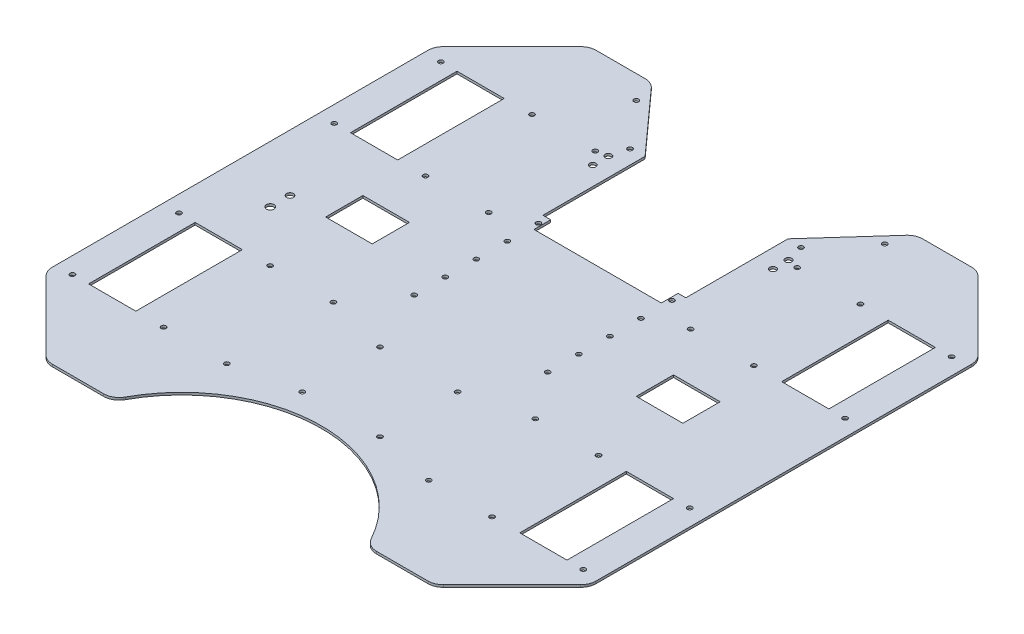
from build123d import *

# Parameters (mm, degrees)
SKETCH_1_R          = 1.55
SKETCH_1_W          = 30.4
SKETCH_1_H          = 68.58
SKETCH_1_R_2        = 2.5
SKETCH_1_R_3        = 2.205
SKETCH_1_R_4        = 2.05
EXTRUDE_1_DEPTH     = 1.5
FILLET_1_R          = 10
FILLET_2_R          = 10
FILLET_3_R          = 10
SKETCH_2_W          = 80
SKETCH_2_H          = 29.628438218
CUT_EXTRUDE_1_DEPTH = 10
SKETCH_3_W          = 30
SKETCH_3_H          = 24
CUT_EXTRUDE_2_DEPTH = 10
SKETCH_1_4_R        = 1.55
CUT_EXTRUDE_3_DEPTH = 10
SKETCH_5_W          = 92
SKETCH_5_H          = 68.528071536
CUT_EXTRUDE_4_DEPTH = 4
SKETCH_6_W          = 82
SKETCH_6_H          = 10.813051581
CUT_EXTRUDE_5_DEPTH = 10


with BuildPart() as part:
    # 草图1 → 凸台-拉伸1 (new body)
    with BuildSketch(Plane(origin=(0, 0, 0), x_dir=(1, 0, 0), z_dir=(0, 1, 0))):
        with BuildLine():
            Line((-85, 175), (-125, 175))
            Line((-125, 175), (-175, 125))
            Line((-175, 125), (-175, -125))
            Line((-175, -125), (-125, -175))
            Line((-125, -175), (-81.710313025, -175))
            ThreePointArc((-81.710313025, -175), (0, -122.728301649), (81.710313025, -175))
            Line((81.710313025, -175), (125, -175))
            Line((125, -175), (175, -125))
            Line((175, -125), (175, 125))
            Line((175, 125), (125, 175))
            Line((125, 175), (85, 175))
            Line((85, 175), (40, 125))
            Line((40, 125), (40, 85))
            Line((40, 85), (-40, 85))
            Line((-40, 85), (-40, 125))
            Line((-40, 125), (-85, 175))
        make_face()
        with Locations((-164.434, -118.58)):
            Circle(SKETCH_1_R, mode=Mode.SUBTRACT)
        with Locations((-105.72, -118.58)):
            Circle(SKETCH_1_R, mode=Mode.SUBTRACT)
        with Locations((-65, -118.58)):
            Circle(SKETCH_1_R, mode=Mode.SUBTRACT)
        with Locations((-25, -110)):
            Circle(SKETCH_1_R, mode=Mode.SUBTRACT)
        with Locations((-138.794, -84.29)):
            Rectangle(SKETCH_1_W, SKETCH_1_H, mode=Mode.SUBTRACT)
        with Locations((-164.434, -50)):
            Circle(SKETCH_1_R, mode=Mode.SUBTRACT)
        with Locations((-105.72, -50)):
            Circle(SKETCH_1_R, mode=Mode.SUBTRACT)
        with Locations((-138.472923085, -17.157455951)):
            Circle(SKETCH_1_R_2, mode=Mode.SUBTRACT)
        with Locations((-138.472923085, -4.457455951)):
            Circle(SKETCH_1_R_3, mode=Mode.SUBTRACT)
        with Locations((-65, -50)):
            Circle(SKETCH_1_R, mode=Mode.SUBTRACT)
        with Locations((-25, -60)):
            Circle(SKETCH_1_R, mode=Mode.SUBTRACT)
        with Locations((25, -110)):
            Circle(SKETCH_1_R, mode=Mode.SUBTRACT)
        with Locations((65, -118.58)):
            Circle(SKETCH_1_R, mode=Mode.SUBTRACT)
        with Locations((105.72, -118.58)):
            Circle(SKETCH_1_R, mode=Mode.SUBTRACT)
        with Locations((164.434, -118.58)):
            Circle(SKETCH_1_R, mode=Mode.SUBTRACT)
        with Locations((25, -60)):
            Circle(SKETCH_1_R, mode=Mode.SUBTRACT)
        with Locations((65, -50)):
            Circle(SKETCH_1_R, mode=Mode.SUBTRACT)
        with Locations((105.72, -50)):
            Circle(SKETCH_1_R, mode=Mode.SUBTRACT)
        with Locations((138.794, -84.29)):
            Rectangle(SKETCH_1_W, SKETCH_1_H, mode=Mode.SUBTRACT)
        with Locations((164.434, -50)):
            Circle(SKETCH_1_R, mode=Mode.SUBTRACT)
        with Locations((-164.434, 50)):
            Circle(SKETCH_1_R, mode=Mode.SUBTRACT)
        with Locations((-138.794, 84.29)):
            Rectangle(SKETCH_1_W, SKETCH_1_H, mode=Mode.SUBTRACT)
        with Locations((-105.72, 50)):
            Circle(SKETCH_1_R, mode=Mode.SUBTRACT)
        with Locations((-65, 50)):
            Circle(SKETCH_1_R, mode=Mode.SUBTRACT)
        with Locations((-164.434, 118.58)):
            Circle(SKETCH_1_R, mode=Mode.SUBTRACT)
        with Locations((-105.72, 118.58)):
            Circle(SKETCH_1_R, mode=Mode.SUBTRACT)
        with Locations((-58, 110)):
            Circle(SKETCH_1_R_4, mode=Mode.SUBTRACT)
        with Locations((-65, 118.58)):
            Circle(SKETCH_1_R, mode=Mode.SUBTRACT)
        with Locations((-58, 120)):
            Circle(SKETCH_1_R_4, mode=Mode.SUBTRACT)
        with Locations((-55, 131)):
            Circle(SKETCH_1_R, mode=Mode.SUBTRACT)
        with Locations((-43, 110)):
            Circle(SKETCH_1_R_4, mode=Mode.SUBTRACT)
        with Locations((-43, 120)):
            Circle(SKETCH_1_R_4, mode=Mode.SUBTRACT)
        with Locations((-80, 160)):
            Circle(SKETCH_1_R, mode=Mode.SUBTRACT)
        with Locations((65, 50)):
            Circle(SKETCH_1_R, mode=Mode.SUBTRACT)
        with Locations((105.72, 50)):
            Circle(SKETCH_1_R, mode=Mode.SUBTRACT)
        with Locations((164.434, 50)):
            Circle(SKETCH_1_R, mode=Mode.SUBTRACT)
        with Locations((138.794, 84.29)):
            Rectangle(SKETCH_1_W, SKETCH_1_H, mode=Mode.SUBTRACT)
        with Locations((43, 110)):
            Circle(SKETCH_1_R_4, mode=Mode.SUBTRACT)
        with Locations((43, 120)):
            Circle(SKETCH_1_R_4, mode=Mode.SUBTRACT)
        with Locations((58, 110)):
            Circle(SKETCH_1_R_4, mode=Mode.SUBTRACT)
        with Locations((58, 120)):
            Circle(SKETCH_1_R_4, mode=Mode.SUBTRACT)
        with Locations((65, 118.58)):
            Circle(SKETCH_1_R, mode=Mode.SUBTRACT)
        with Locations((55, 131)):
            Circle(SKETCH_1_R, mode=Mode.SUBTRACT)
        with Locations((80, 160)):
            Circle(SKETCH_1_R, mode=Mode.SUBTRACT)
        with Locations((105.72, 118.58)):
            Circle(SKETCH_1_R, mode=Mode.SUBTRACT)
        with Locations((164.434, 118.58)):
            Circle(SKETCH_1_R, mode=Mode.SUBTRACT)
    extrude(amount=EXTRUDE_1_DEPTH)

    # 圆角1
    fillet_1_edges = [part.edges().sort_by_distance(p)[0] for p in [
        (-40, 0.75, -125),
    ]]
    fillet(fillet_1_edges, radius=FILLET_1_R)

    # 圆角2
    fillet_2_edges = [part.edges().sort_by_distance(p)[0] for p in [
        (40, 0.75, -125),
    ]]
    fillet(fillet_2_edges, radius=FILLET_2_R)

    # 圆角3
    fillet_3_edges = [part.edges().sort_by_distance(p)[0] for p in [
        (-85, 0.75, -175),
        (85, 0.75, -175),
        (125, 0.75, -175),
        (175, 0.75, -125),
        (175, 0.75, 125),
        (125, 0.75, 175),
        (81.710313025, 0.75, 175),
        (-81.710313025, 0.75, 175),
        (-125, 0.75, 175),
        (-175, 0.75, 125),
        (-175, 0.75, -125),
        (-125, 0.75, -175),
    ]]
    fillet(fillet_3_edges, radius=FILLET_3_R)

    # 草图2 → 切除-拉伸1 (cut)
    with BuildSketch(Plane(origin=(0, 1.5, 0), x_dir=(1, 0, 0), z_dir=(0, 1, 0))):
        with Locations((0, 70.185780891)):
            Rectangle(SKETCH_2_W, SKETCH_2_H)
    extrude(amount=-CUT_EXTRUDE_1_DEPTH, mode=Mode.SUBTRACT)

    # 草图3 → 切除-拉伸2 (cut)
    with BuildSketch(Plane(origin=(0, 1.5, 0), x_dir=(1, 0, 0), z_dir=(0, 1, 0))):
        with Locations((-100, 7)):
            Rectangle(SKETCH_3_W, SKETCH_3_H)
        with Locations((100, 7)):
            Rectangle(SKETCH_3_W, SKETCH_3_H)
    extrude(amount=-CUT_EXTRUDE_2_DEPTH, mode=Mode.SUBTRACT)

    # 草图1<4> → 切除-拉伸3 (cut)
    with BuildSketch(Plane(origin=(0, 0, 0), x_dir=(1, 0, 0), z_dir=(0, 1, 0))):
        with Locations((43, -20)):
            Circle(SKETCH_1_4_R)
        with Locations((43, 0)):
            Circle(SKETCH_1_4_R)
        with Locations((43, 20)):
            Circle(SKETCH_1_4_R)
        with Locations((43, 40)):
            Circle(SKETCH_1_4_R)
        with Locations((43, 60)):
            Circle(SKETCH_1_4_R)
        with Locations((-43, -20)):
            Circle(SKETCH_1_4_R)
        with Locations((-43, 0)):
            Circle(SKETCH_1_4_R)
        with Locations((-43, 20)):
            Circle(SKETCH_1_4_R)
        with Locations((-43, 40)):
            Circle(SKETCH_1_4_R)
        with Locations((-43, 60)):
            Circle(SKETCH_1_4_R)
    extrude(amount=CUT_EXTRUDE_3_DEPTH, mode=Mode.SUBTRACT)

    # 草图5 → 切除-拉伸4 (cut)
    with BuildSketch(Plane.XZ):
        with Locations((0, -100.191724722)):
            Rectangle(SKETCH_5_W, SKETCH_5_H)
    extrude(amount=-CUT_EXTRUDE_4_DEPTH, mode=Mode.SUBTRACT)

    # 草图6 → 切除-拉伸5 (cut)
    with BuildSketch(Plane(origin=(0, 1.5, 0), x_dir=(1, 0, 0), z_dir=(0, 1, 0))):
        with Locations((0, 60.521163164)):
            Rectangle(SKETCH_6_W, SKETCH_6_H)
    extrude(amount=-CUT_EXTRUDE_5_DEPTH, mode=Mode.SUBTRACT)


solid = part.part
